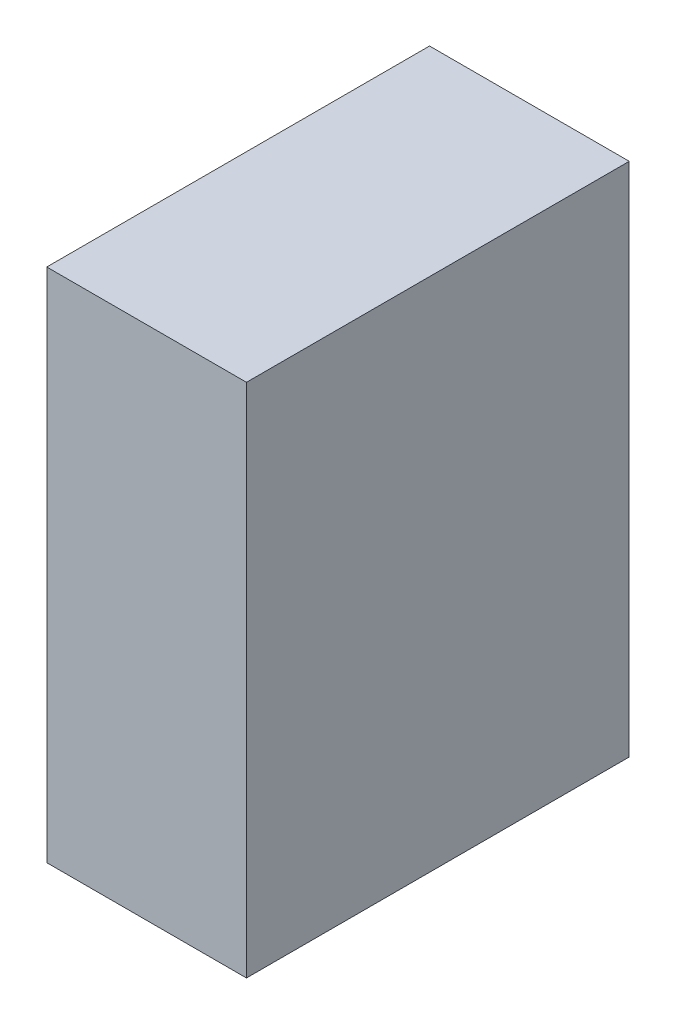
from build123d import *

# Parameters (mm, degrees)
SKETCH1_W           = 146.05
SKETCH1_H           = 196.85
BOSS_EXTRUDE1_DEPTH = 76.2
SKETCH2_R           = 3.175
CUT_EXTRUDE1_DEPTH  = 74.5679992
SKETCH3_R           = 3.96875
CUT_EXTRUDE2_DEPTH  = 50.5679964
SKETCH4_R           = 3.175
CUT_EXTRUDE3_DEPTH  = 39.2679936
SKETCH5_R           = 3.96875
CUT_EXTRUDE4_DEPTH  = 6.2680088
SKETCH6_R           = 4
CUT_EXTRUDE5_DEPTH  = 13.0800094


with BuildPart() as part:
    # Sketch1 → Boss-Extrude1 (new body)
    with BuildSketch(Plane(origin=(0, 0, 0), x_dir=(0, 0, -1), z_dir=(1, 0, 0))):
        with Locations((32.001485149, -25.494306931)):
            Rectangle(SKETCH1_W, SKETCH1_H)
    extrude(amount=BOSS_EXTRUDE1_DEPTH)

    # Sketch2 → Cut-Extrude1 (cut)
    with BuildSketch(Plane.XZ.offset(123.919306931)):
        with Locations((19.96, 29.553514851)):
            Circle(SKETCH2_R)
        with Locations((28.84213013, 29.179530425)):
            Circle(SKETCH2_R)
    extrude(amount=-CUT_EXTRUDE1_DEPTH, mode=Mode.SUBTRACT)

    # Sketch3 → Cut-Extrude2 (cut)
    with BuildSketch(Plane.XZ.offset(123.919306931)):
        with Locations((28.840626577, 29.145383002)):
            Circle(SKETCH3_R)
        with Locations((19.96, 29.553514851)):
            Circle(SKETCH3_R)
    extrude(amount=-CUT_EXTRUDE2_DEPTH, mode=Mode.SUBTRACT)

    # Sketch4 → Cut-Extrude3 (cut)
    with BuildSketch(Plane.XZ.offset(123.919306931)):
        with Locations((34.46, -30.446485149)):
            Circle(SKETCH4_R)
    extrude(amount=-CUT_EXTRUDE3_DEPTH, mode=Mode.SUBTRACT)

    # Sketch5 → Cut-Extrude4 (cut)
    with BuildSketch(Plane.XZ.offset(123.919306931)):
        with Locations((34.46, -30.446485149)):
            Circle(SKETCH5_R)
    extrude(amount=-CUT_EXTRUDE4_DEPTH, mode=Mode.SUBTRACT)

    # Sketch6 → Cut-Extrude5 (cut)
    with BuildSketch(Plane(origin=(0, 0, -105.026485149), x_dir=(-1, 0, 0), z_dir=(0, 0, -1))):
        with Locations((-24.96, -56.151306931)):
            Circle(SKETCH6_R)
        with Locations((-24.96, 13.848693069)):
            Circle(SKETCH6_R)
    extrude(amount=-CUT_EXTRUDE5_DEPTH, mode=Mode.SUBTRACT)


solid = part.part
